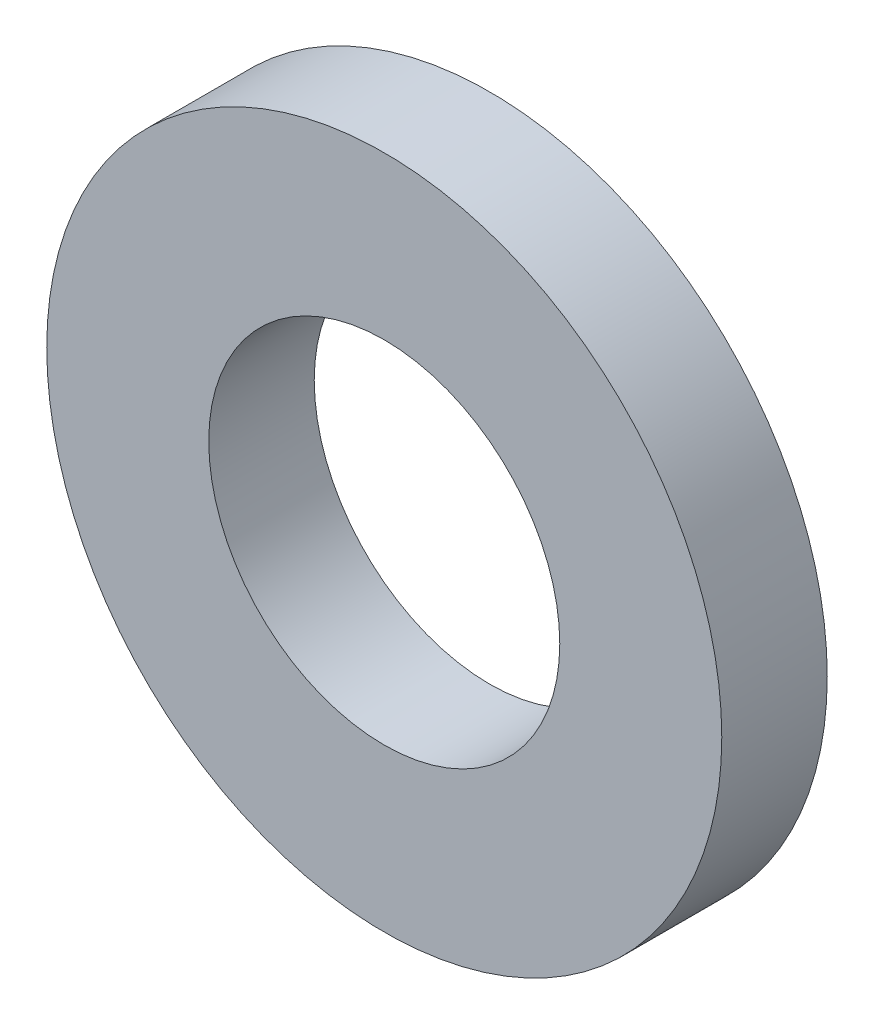
from build123d import *

# Parameters (mm, degrees)
SKETCH1_R           = 12.7
SKETCH1_R_2         = 6.604
BOSS_EXTRUDE1_DEPTH = 1.984375


with BuildPart() as part:
    # Sketch1 → Boss-Extrude1 (new, symmetric)
    with BuildSketch(Plane.XY):
        Circle(SKETCH1_R)
        Circle(SKETCH1_R_2, mode=Mode.SUBTRACT)
    extrude(amount=BOSS_EXTRUDE1_DEPTH, both=True)


solid = part.part
